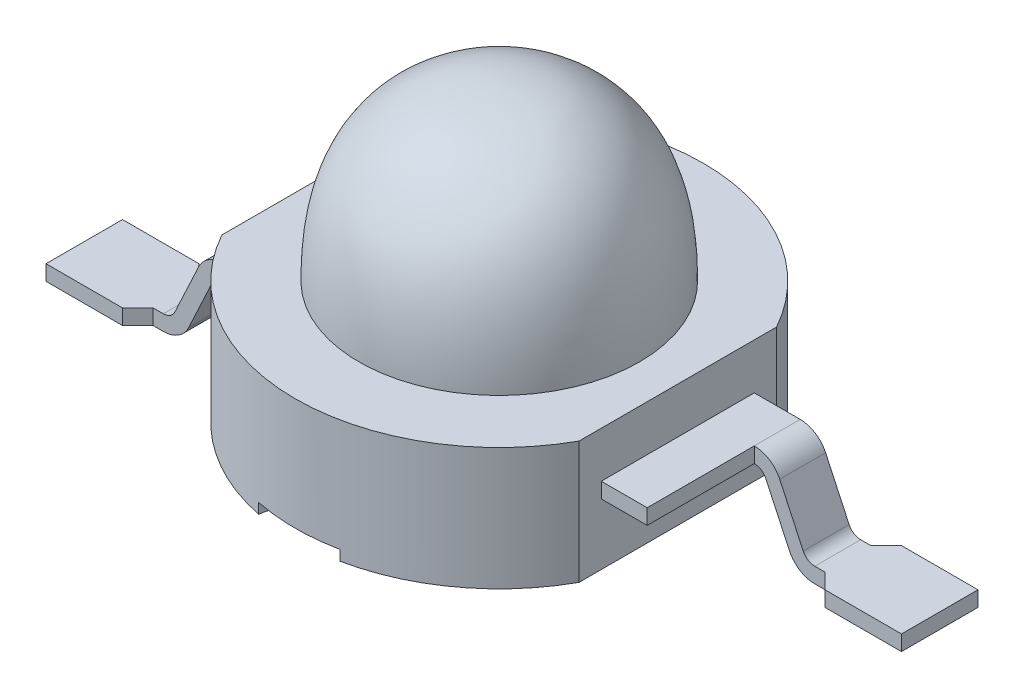
from build123d import *

# Parameters (mm, degrees)
BOSS_EXTRUDE1_DEPTH = 2.4
SKETCH2_R           = 2.75
BOSS_EXTRUDE2_DEPTH = 0.25
SKETCH3_R           = 2
BOSS_EXTRUDE3_DEPTH = 0.3
SKETCH5_W           = 8.3
SKETCH5_H           = 3
BOSS_EXTRUDE4_DEPTH = 0.15
SKETCH6_W           = 0.9
SKETCH6_H           = 0.3
SKETCH8_W           = 0.9
SKETCH8_H           = 0.3
SKETCH10_W          = 1.5
SKETCH10_H          = 0.3
BOSS_EXTRUDE5_DEPTH = 1.8
SKETCH11_W          = 1.5
SKETCH11_H          = 0.3
BOSS_EXTRUDE6_DEPTH = 1.8
CHAMFER1_SIZE       = 0.3
SKETCH12_R          = 0.8
CUT_EXTRUDE1_DEPTH  = 0.2


with BuildPart() as part:
    # Sketch1 → Boss-Extrude1 (new body)
    with BuildSketch(Plane(origin=(0, 0, 0), x_dir=(1, 0, 0), z_dir=(0, 1, 0))):
        with BuildLine():
            Line((-3.5, 1.936491673), (-3.5, -1.936491673))
            ThreePointArc((-3.5, -1.936491673), (0, -4), (3.5, -1.936491673))
            Line((3.5, -1.936491673), (3.5, 1.936491673))
            ThreePointArc((3.5, 1.936491673), (0, 4), (-3.5, 1.936491673))
        make_face()
    extrude(amount=BOSS_EXTRUDE1_DEPTH)

    # Sketch2 → Boss-Extrude2 (add)
    with BuildSketch(Plane(origin=(0, 0, 0), x_dir=(1, 0, 0), z_dir=(0, 1, 0))):
        with Locations(Location((0, 0, 0), (0, 0, 270))):
            Circle(SKETCH2_R)
    extrude(amount=-BOSS_EXTRUDE2_DEPTH)

    # Sketch3 → Boss-Extrude3 (add)
    with BuildSketch(Plane(origin=(0, 2.4, 0), x_dir=(1, 0, 0), z_dir=(0, 1, 0))):
        with Locations(Location((0, 0, 0), (0, 0, 270))):
            Circle(SKETCH3_R)
    extrude(amount=BOSS_EXTRUDE3_DEPTH)

    # Sketch5 → Boss-Extrude4 (add, symmetric)
    with BuildSketch(Plane(origin=(0, 1.35, 0), x_dir=(-1, 0, 0), z_dir=(0, 1, 0))):
        with Locations((-0.25, 0)):
            Rectangle(SKETCH5_W, SKETCH5_H)
    extrude(amount=BOSS_EXTRUDE4_DEPTH, both=True)

    # Sweep2: sweep along a path in Sketch7
    with BuildLine(Plane.XY.offset(-1.05)) as sweep2_path:
        Line((5.785802313, -0.1), (5.585802313, -0.1))
        ThreePointArc((5.585802313, -0.1), (5.37088247, -0.037356578), (5.223279198, 0.130952695))
        Line((5.223279198, 0.130952695), (4.762523115, 1.119047305))
        ThreePointArc((4.762523115, 1.119047305), (4.614919843, 1.287356578), (4.4, 1.35))
    # Sketch6 → Sweep2 (sweep)
    with BuildSketch(Plane(origin=(4.4, 0, 0), x_dir=(0, 0, -1), z_dir=(1, 0, 0))):
        with Locations((1.05, 1.35)):
            Rectangle(SKETCH6_W, SKETCH6_H)
    sweep(path=sweep2_path.line)

    # Sweep3: sweep along a path in Sketch9
    with BuildLine(Plane.XY.offset(1.05)) as sweep3_path:
        Line((-5.285802313, -0.1), (-5.085802313, -0.1))
        ThreePointArc((-5.085802313, -0.1), (-4.87088247, -0.037356578), (-4.723279198, 0.130952695))
        Line((-4.723279198, 0.130952695), (-4.262523115, 1.119047305))
        ThreePointArc((-4.262523115, 1.119047305), (-4.114919843, 1.287356578), (-3.9, 1.35))
    # Sketch8 → Sweep3 (sweep)
    with BuildSketch(Plane.ZY.offset(3.9)):
        with Locations((1.05, 1.35)):
            Rectangle(SKETCH8_W, SKETCH8_H)
    sweep(path=sweep3_path.line)

    # Sketch10 → Boss-Extrude5 (add)
    with BuildSketch(Plane.ZY.offset(5.285802313)):
        with Locations((1.05, -0.1)):
            Rectangle(SKETCH10_W, SKETCH10_H)
    extrude(amount=BOSS_EXTRUDE5_DEPTH)

    # Sketch11 → Boss-Extrude6 (add)
    with BuildSketch(Plane(origin=(5.785802313, 0, 0), x_dir=(0, 0, -1), z_dir=(1, 0, 0))):
        with Locations((1.05, -0.1)):
            Rectangle(SKETCH11_W, SKETCH11_H)
    extrude(amount=BOSS_EXTRUDE6_DEPTH)

    # Chamfer1
    chamfer1_edges = [part.edges().sort_by_distance(p)[0] for p in [
        (5.785802313, -0.1, -0.3),
        (5.785802313, -0.1, -1.8),
        (-5.285802313, -0.1, 0.3),
        (-5.285802313, -0.1, 1.8),
    ]]
    chamfer(chamfer1_edges, length=CHAMFER1_SIZE - 0.0001)  # a hair under: the kernel refuses the full size

    # Sketch12 → Cut-Extrude1 (cut)
    with BuildSketch(Plane.XZ):
        with Locations((0, 4)):
            Circle(SKETCH12_R)
        with Locations((0, -4)):
            Circle(SKETCH12_R)
    extrude(amount=-CUT_EXTRUDE1_DEPTH, mode=Mode.SUBTRACT)


with BuildPart() as body_2:
    # Sketch4 → Revolve1 (revolve)
    with BuildSketch(Plane.XY):
        with BuildLine():
            Line((0, 2.4), (0, 5.7))
            add(Edge.make_bspline(
                [(2.75, 2.4), (2.768262319, 4.804056581), (0.735398067, 5.678302049), (0, 5.7)],
                knots=[0, 0, 0, 0.79605036, 1, 1, 1], degree=2))
            Line((2.75, 2.4), (0, 2.4))
        make_face()
    revolve(axis=Axis((0, 2.4, 0), (0, 1, 0)))


solid = Compound([part.part, body_2.part])
